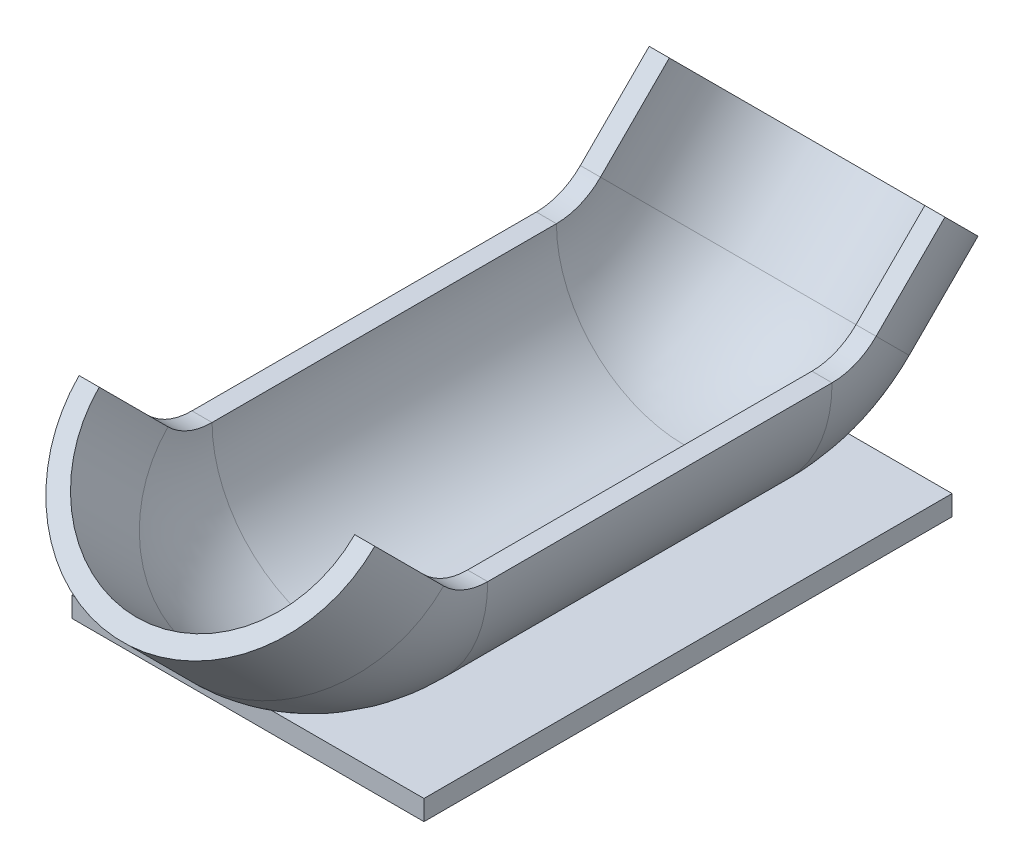
from build123d import *

# Parameters (mm, degrees)
SKETCH6_W           = 70
SKETCH6_H           = 105
BOSS_EXTRUDE1_DEPTH = 4


with BuildPart() as part:
    # Sweep2: sweep along a path in Sketch3
    with BuildLine(Plane(origin=(0, 0, 0), x_dir=(0, 0, -1), z_dir=(1, 0, 0))) as sweep2_path:
        Line((76.2, -2.212849708), (62.515728753, -15.897120955))
        ThreePointArc((62.515728753, -15.897120955), (49.5387948, -24.568031008), (34.231457505, -27.612849708))
        Line((34.231457505, -27.612849708), (-34.231457505, -27.612849708))
        ThreePointArc((-34.231457505, -27.612849708), (-49.5387948, -24.568031008), (-62.515728753, -15.897120955))
        Line((-62.515728753, -15.897120955), (-76.2, -2.212849708))
    # Sketch1 → Sweep2 (sweep)
    with BuildSketch(Plane.XY):
        with BuildLine():
            Line((-25.4, 0), (-29.4, 0))
            ThreePointArc((-29.4, 0), (0, -29.4), (29.4, 0))
            Line((29.4, 0), (25.4, 0))
            ThreePointArc((25.4, 0), (0, -25.4), (-25.4, 0))
        make_face()
    sweep(path=sweep2_path.line)

    # Sketch6 → Boss-Extrude1 (add)
    with BuildSketch(Plane(origin=(0, -29.4, 0), x_dir=(-1, 0, 0), z_dir=(0, -1, 0))):
        Rectangle(SKETCH6_W, SKETCH6_H)
    extrude(amount=-BOSS_EXTRUDE1_DEPTH)


solid = part.part
